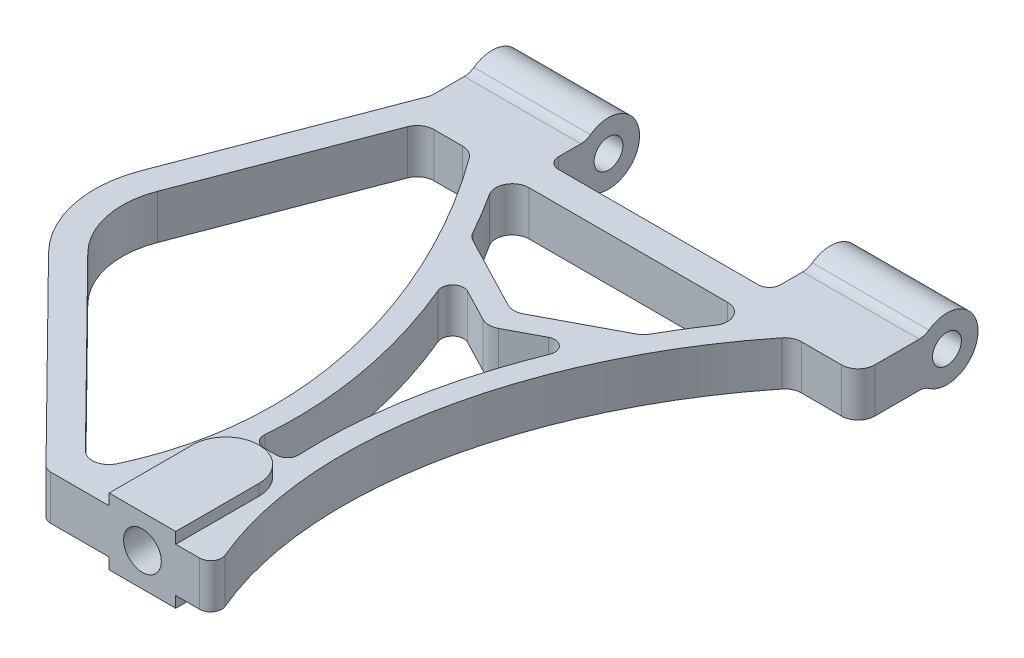
from build123d import *

# Parameters (mm, degrees)
EXTRUDE_1_DEPTH        = 4
FILLET_1_R             = 4
SKETCH_4_R             = 2.6
CUT_EXTRUDE_1_DEPTH    = 146.708473979
FILLET_2_R             = 3
FILLET_3_R             = 3
SKETCH_6_R             = 6
EXTRUDE_3_DEPTH        = 6
CUT_EXTRUDE_2_DEPTH    = 12
FILLET_4_R             = 3
FILLET_5_R             = 2
FILLET_6_R             = 2
EXTRUDE_5_DEPTH        = 8
FILLET_7_R             = 2
FILLET_8_R             = 3
FILLET_9_R             = 2
FILLET_10_R            = 2
SKETCH_11_R            = 3
CUT_EXTRUDE_3_DEPTH    = 19
HOLE_WIZARD_M8_3_D     = 6.8
HOLE_WIZARD_M8_3_DEPTH = 15
HOLE_WIZARD_M8_3_TIP   = 2.042926105
SKETCH_14_R            = 5.6
SKETCH_14_R_2          = 2.6
EXTRUDE_6_DEPTH        = 21
EXTRUDE_START          = -21
SKETCH_15_R            = 5.6
SKETCH_15_R_2          = 2.6
EXTRUDE_7_DEPTH        = 21
FILLET_11_R            = 3


with BuildPart() as part:
    # 草图1 → 凸台-拉伸1 (new, symmetric)
    with BuildSketch(Plane(origin=(0, 0, 0), x_dir=(1, 0, 0), z_dir=(0, 1, 0))):
        with BuildLine():
            Line((-20, 0), (-41, 0))
            Line((-41, 0), (-41, -15))
            Line((-41, -15), (-55.415081473, -52.780871033))
            ThreePointArc((-55.415081473, -52.780871033), (-56.302035651, -64.020992263), (-50.968339036, -73.954707247))
            Line((-50.968339036, -73.954707247), (-17.38942166, -108))
            Line((-17.38942166, -108), (13.387176951, -108))
            add(Edge.make_bspline(
                [(11.643587669, -103.995199619), (12.175396299, -105.343239297), (12.756125427, -106.67877823), (13.387176951, -108)],
                knots=[1, 1, 1, 1, 1.048078106, 1.048078106, 1.048078106, 1.048078106], degree=3))
            add(Edge.make_bspline(
                [(29.336714137, -20), (14.953042407, -37.358957509), (2.894073745, -68.302879354), (9.112352893, -97.578972573), (11.643587669, -103.995199619)],
                knots=[0, 0, 0, 0, 0.771163971, 1, 1, 1, 1], degree=3))
            Line((29.336714137, -20), (41, -20))
            Line((41, -20), (41, -15))
            Line((41, -15), (41, 0))
            Line((41, 0), (20, 0))
            Line((20, 0), (20, -15))
            Line((20, -15), (-20, -15))
            Line((-20, -15), (-20, 0))
        make_face()
        with BuildLine():
            Line((-37.556142637, -20), (-28.778071319, -20))
            add(Edge.make_bspline(
                [(-28.778071319, -20), (-11.398449347, -43.180650425), (1.816105739, -77.326056937), (-13.829589339, -104.488932663)],
                knots=[0, 0, 0, 0, 1, 1, 1, 1], degree=3))
            Line((-13.829589339, -104.488932663), (-47.408506715, -70.44363991))
            ThreePointArc((-47.408506715, -70.44363991), (-51.408779177, -62.993353671), (-50.743563543, -54.563262749))
            Line((-50.743563543, -54.563262749), (-37.556142637, -20))
        make_face(mode=Mode.SUBTRACT)
    extrude(amount=EXTRUDE_1_DEPTH, both=True)

    # 圆角1
    fillet_1_edges = [part.edges().sort_by_distance(p)[0] for p in [
        (-30.5, 4, 0),
        (-30.5, -4, 0),
        (30.5, -4, 0),
        (30.5, 4, 0),
    ]]
    fillet(fillet_1_edges, radius=FILLET_1_R - 0.0001)  # a hair under: the kernel refuses the full size

    # 草图4 → 切除-拉伸1 (cut, through all)
    with BuildSketch(Plane(origin=(41, 0, 0), x_dir=(0, 0, -1), z_dir=(1, 0, 0))):
        with Locations((-4, 0)):
            Circle(SKETCH_4_R)
    extrude(amount=-CUT_EXTRUDE_1_DEPTH, mode=Mode.SUBTRACT)

    # 圆角2
    fillet_2_edges = [part.edges().sort_by_distance(p)[0] for p in [
        (-41, 0, 15),
        (-28.778071319, -2, 20),
        (-37.556142637, 0, 20),
        (41, 0, 20),
        (29.336714137, -2, 20),
    ]]
    fillet(fillet_2_edges, radius=FILLET_2_R)

    # 圆角3
    fillet_3_edges = [part.edges().sort_by_distance(p)[0] for p in [
        (-13.829589339, -2, 104.488932663),
    ]]
    fillet(fillet_3_edges, radius=FILLET_3_R)

    # 草图6 → 凸台-拉伸3 (add, symmetric)
    with BuildSketch(Plane(origin=(0, 0, 0), x_dir=(1, 0, 0), z_dir=(0, 1, 0))):
        with BuildLine():
            ThreePointArc((6, -93), (0, -99), (-6, -93))
            Line((-6, -93), (-6, -108))
            Line((-6, -108), (6, -108))
            Line((6, -108), (6, -93))
        make_face()
        with Locations((0, -93)):
            Circle(SKETCH_6_R)
    extrude(amount=EXTRUDE_3_DEPTH, both=True)

    # 草图9 → 切除-拉伸2 (cut)
    with BuildSketch(Plane(origin=(0, 4, 0), x_dir=(1, 0, 0), z_dir=(0, 1, 0))):
        with BuildLine():
            Line((-3.301596304, -85), (3.279031365, -85))
            add(Edge.make_bspline(
                [(23.82705745, -20.5), (19.505008519, -26.151605233), (15.701306988, -32.362525218), (9.075946345, -46.254561975), (6.412430162, -54.023271907), (3.266661612, -69.561604001), (2.686935669, -77.315763608), (3.279031365, -85)],
                knots=[0.025253164, 0.025253164, 0.025253164, 0.025253164, 0.25, 0.25, 0.5, 0.5, 0.73810851, 0.73810851, 0.73810851, 0.73810851], degree=3))
            Line((23.82705745, -20.5), (-23.464882608, -20.5))
            add(Edge.make_bspline(
                [(-23.464882608, -20.5), (-19.745298249, -25.752793711), (-16.265276937, -31.478555693), (-9.934110548, -44.200553579), (-7.185840369, -51.267285983), (-4.428907167, -62.148768173), (-3.737975942, -65.822957616), (-2.903507141, -73.212236362), (-2.760056502, -76.927560065), (-3.008657599, -82.090891991), (-3.128742658, -83.54736568), (-3.301596304, -85)],
                knots=[0.023659765, 0.023659765, 0.023659765, 0.023659765, 0.25, 0.25, 0.5, 0.5, 0.625, 0.625, 0.75, 0.75, 0.799185621, 0.799185621, 0.799185621, 0.799185621], degree=3))
        make_face()
    extrude(amount=-CUT_EXTRUDE_2_DEPTH, mode=Mode.SUBTRACT)

    # 圆角4
    fillet_4_edges = [part.edges().sort_by_distance(p)[0] for p in [
        (23.82705745, 0, 20.5),
        (-23.464882608, 0, 20.5),
    ]]
    fillet(fillet_4_edges, radius=FILLET_4_R)

    # 圆角5
    fillet_5_edges = [part.edges().sort_by_distance(p)[0] for p in [
        (-3.301596304, 0, 85),
        (3.279031365, 0, 85),
    ]]
    fillet(fillet_5_edges, radius=FILLET_5_R)

    # 圆角6
    fillet_6_edges = [part.edges().sort_by_distance(p)[0] for p in [
        (-20, 0, 15),
        (20, 0, 15),
    ]]
    fillet(fillet_6_edges, radius=FILLET_6_R)

    # 草图10 → 凸台-拉伸5 (add)
    with BuildSketch(Plane(origin=(0, 4, 0), x_dir=(1, 0, 0), z_dir=(0, 1, 0))):
        Polygon((-17.607172891, -36.773881534), (0.006004111, -45.946117812), (17.402210236, -36.768943973), (15.535837047, -33.231056027), (-0.006004111, -41.429980382), (-15.759640154, -33.226118466), align=None)
    extrude(amount=-EXTRUDE_5_DEPTH)

    # 圆角7
    fillet_7_edges = [part.edges().sort_by_distance(p)[0] for p in [
        (12.323790715, 0, 39.448007353),
        (-12.270659934, 0, 39.552923483),
    ]]
    fillet(fillet_7_edges, radius=FILLET_7_R)

    # 圆角8
    fillet_8_edges = [part.edges().sort_by_distance(p)[0] for p in [
        (-15.400235002, 0, 33.413282257),
        (15.491481072, 0, 33.254455525),
        (0.006004111, 0, 45.946117812),
        (-0.006004111, 0, 41.429980382),
    ]]
    fillet(fillet_8_edges, radius=FILLET_8_R)

    # 圆角9
    fillet_9_edges = [part.edges().sort_by_distance(p)[0] for p in [
        (13.387176951, -2, 108),
    ]]
    fillet(fillet_9_edges, radius=FILLET_9_R)

    # 圆角10
    fillet_10_edges = [part.edges().sort_by_distance(p)[0] for p in [
        (-17.38942166, 0, 108),
    ]]
    fillet(fillet_10_edges, radius=FILLET_10_R)

    # 草图11 → 切除-拉伸3 (cut)
    with BuildSketch(Plane.XY.offset(108)):
        Circle(SKETCH_11_R)
    extrude(amount=-CUT_EXTRUDE_3_DEPTH, mode=Mode.SUBTRACT)

    # M8 螺纹孔3
    with Locations(Plane.XY.offset(108)):
        with Locations((0, 0)):
            Hole(HOLE_WIZARD_M8_3_D / 2, depth=HOLE_WIZARD_M8_3_DEPTH)
            with Locations((0, 0, -(HOLE_WIZARD_M8_3_DEPTH + HOLE_WIZARD_M8_3_TIP / 2))):  # 118° drill point
                Cone(0, HOLE_WIZARD_M8_3_D / 2, HOLE_WIZARD_M8_3_TIP, mode=Mode.SUBTRACT)

    # 草图14 → 凸台-拉伸6 (add)
    with BuildSketch(Plane(origin=(41, 0, 0), x_dir=(0, 0, -1), z_dir=(1, 0, 0))):
        with Locations((-4, 0)):
            Circle(SKETCH_14_R)
        with Locations((-4, 0)):
            Circle(SKETCH_14_R_2, mode=Mode.SUBTRACT)
    extrude(amount=-EXTRUDE_6_DEPTH)

    # 草图15 → 凸台-拉伸7 (add)
    with BuildSketch(Plane.ZY.offset(41).offset(EXTRUDE_START)):
        with Locations((4, 0)):
            Circle(SKETCH_15_R)
        with Locations(Location((4, 0, 0), (0, 0, 180))):
            Circle(SKETCH_15_R_2, mode=Mode.SUBTRACT)
    extrude(amount=EXTRUDE_7_DEPTH)

    # 圆角11
    fillet_11_edges = [part.edges().sort_by_distance(p)[0] for p in [
        (30.5, -4, 7.919183588),
        (30.5, 4, 7.919183588),
        (-30.5, -4, 7.919183588),
        (-30.5, 4, 7.919183588),
    ]]
    fillet(fillet_11_edges, radius=FILLET_11_R)


solid = part.part
